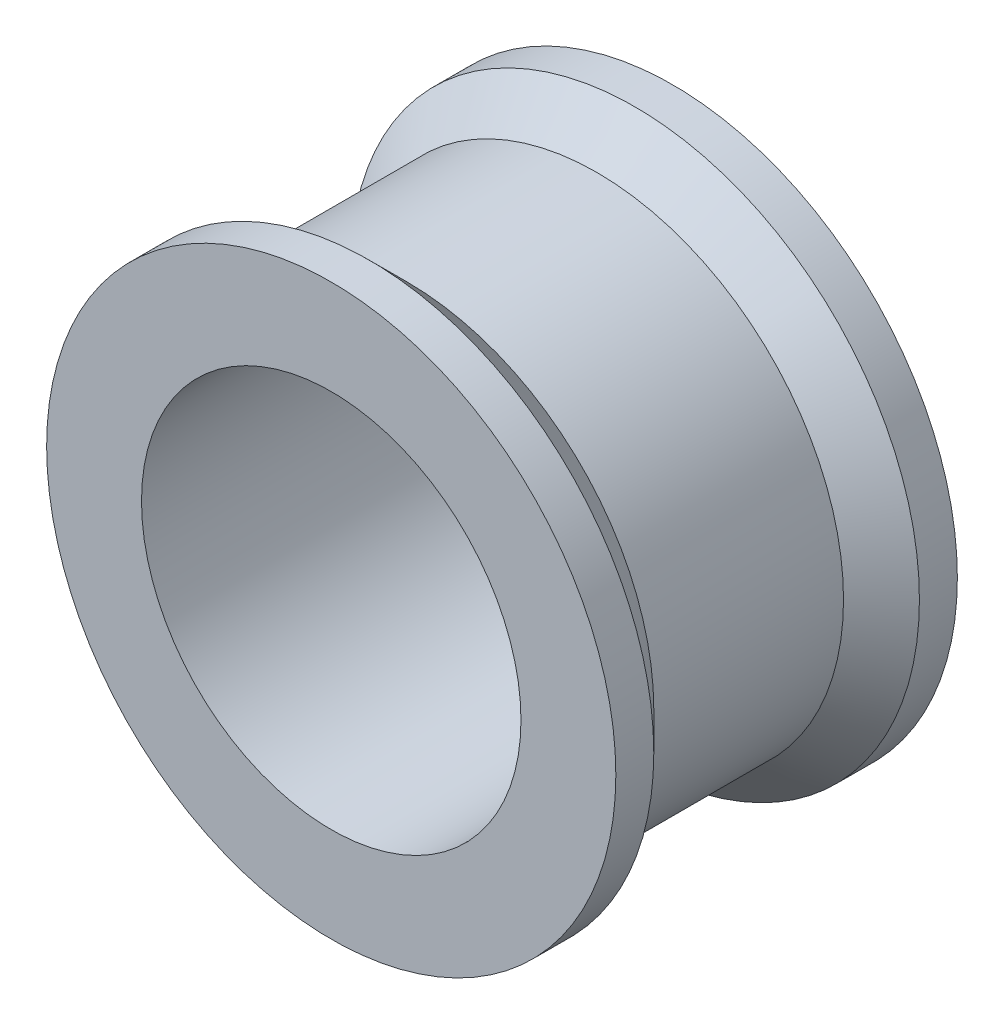
from build123d import *

# Parameters (mm, degrees)
SKETCH1_R           = 7.5
SKETCH1_R_2         = 5
BOSS_EXTRUDE1_DEPTH = 1
SKETCH2_R           = 6.5
SKETCH2_R_2         = 5
BOSS_EXTRUDE2_DEPTH = 3.5
CHAMFER1_SIZE       = 1


with BuildPart() as part:
    # Sketch1 → Boss-Extrude1 (new body)
    with BuildSketch(Plane.XY):
        Circle(SKETCH1_R)
        Circle(SKETCH1_R_2, mode=Mode.SUBTRACT)
    extrude(amount=BOSS_EXTRUDE1_DEPTH)

    # Sketch2 → Boss-Extrude2 (add)
    with BuildSketch(Plane.XY.offset(1)):
        Circle(SKETCH2_R)
        Circle(SKETCH2_R_2, mode=Mode.SUBTRACT)
    extrude(amount=BOSS_EXTRUDE2_DEPTH)

    # Chamfer1
    chamfer1_edges = [part.edges().sort_by_distance(p)[0] for p in [
        (-6.5, 0, 1),
    ]]
    chamfer(chamfer1_edges, length=CHAMFER1_SIZE - 0.0001)  # a hair under: the kernel refuses the full size

    # Mirror5: part across plane


with BuildPart() as part_1:
    add(part.part)
    add(part.part.mirror(Plane.XY.offset(4.5)))


solid = part_1.part
